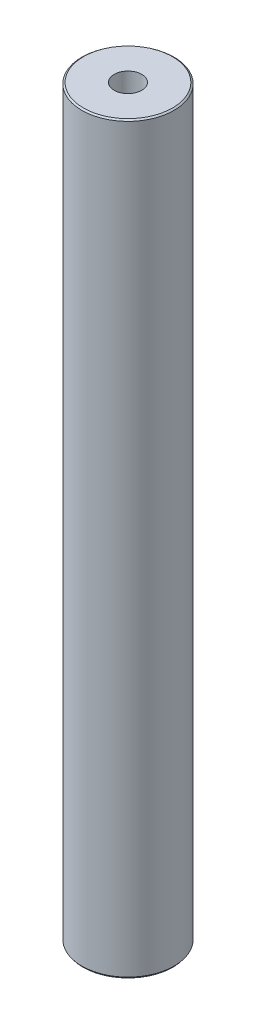
from build123d import *
from OCP.BRepFilletAPI import BRepFilletAPI_MakeChamfer

# Parameters (mm, degrees)
SKETCH1_R           = 12.5
BOSS_EXTRUDE1_DEPTH = 201.640800968
SKETCH2_R           = 3.748490363
CUT_EXTRUDE1_DEPTH  = 203.414210507
CHAMFER1_SIZE       = 0.328489444
CHAMFER1_SIZE2      = 0.438586035


with BuildPart() as part:
    # Sketch1 → Boss-Extrude1 (new body)
    with BuildSketch(Plane(origin=(0, 0, 0), x_dir=(1, 0, 0), z_dir=(0, 1, 0))):
        Circle(SKETCH1_R)
    extrude(amount=BOSS_EXTRUDE1_DEPTH)

    # Sketch2 → Cut-Extrude1 (cut, through all)
    with BuildSketch(Plane(origin=(0, 0, 0), x_dir=(1, 0, 0), z_dir=(0, 1, 0))):
        Circle(SKETCH2_R)
    extrude(amount=CUT_EXTRUDE1_DEPTH, mode=Mode.SUBTRACT)

    # Chamfer1: one chamfer whose edges measure the first distance from different faces: ONE call of the kernel's chamfer builder (chamfer() names one face for all edges)
    chamfer1_edges_1 = [part.edges().sort_by_distance(p)[0] for p in [
        (-12.5, 201.640800968, 0),
    ]]
    chamfer1_side_1 = [part.faces().sort_by_distance(p)[0] for p in [
        (-12.5, 100.820400484, 0),
    ]]
    chamfer1_edges_2 = [part.edges().sort_by_distance(p)[0] for p in [
        (-12.5, 0, 0),
    ]]
    chamfer1_side_2 = [part.faces().sort_by_distance(p)[0] for p in [
        (-12.146446609, 0, 0),
    ]]
    chamfer1 = BRepFilletAPI_MakeChamfer(part.part.solid().wrapped)
    for e in chamfer1_edges_1:
        chamfer1.Add(CHAMFER1_SIZE, CHAMFER1_SIZE2, e.wrapped, chamfer1_side_1[0].wrapped)  # the first distance lies on this face
    for e in chamfer1_edges_2:
        chamfer1.Add(CHAMFER1_SIZE, CHAMFER1_SIZE2, e.wrapped, chamfer1_side_2[0].wrapped)  # the first distance lies on this face
    add(Compound.cast(chamfer1.Shape()), mode=Mode.REPLACE)


solid = part.part
